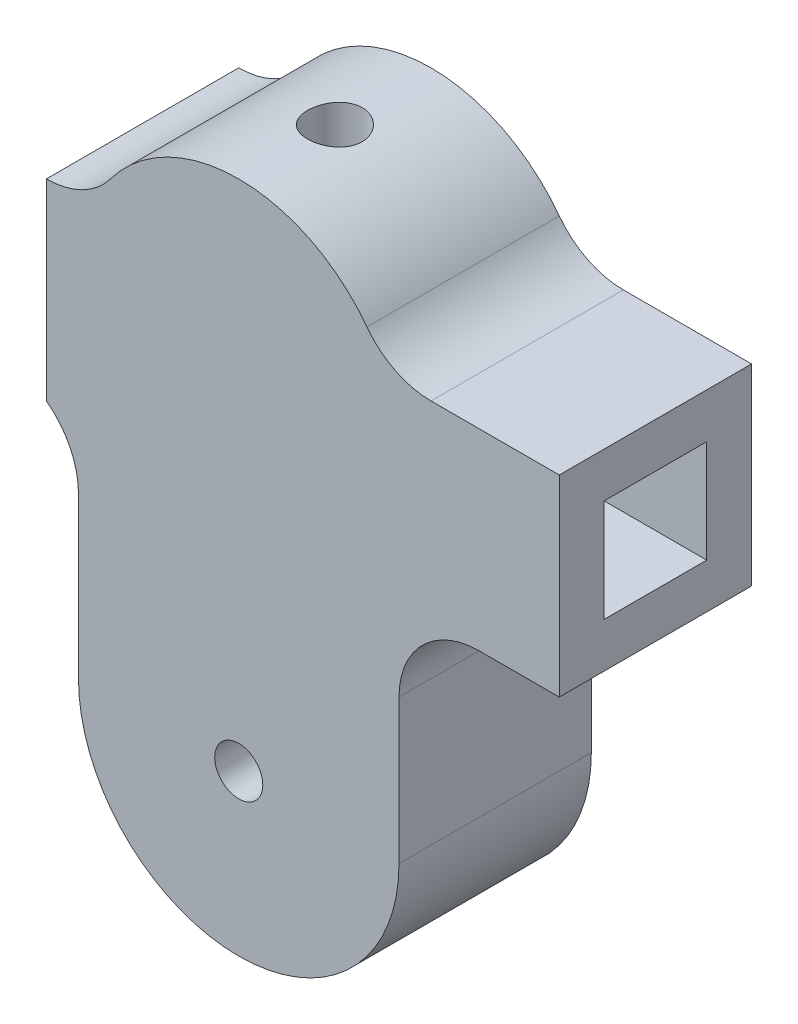
from build123d import *

# Parameters (mm, degrees)
BOSS_EXTRUDE1_DEPTH      = 12
SKETCH4_R                = 1.5
CUT_EXTRUDE2_DEPTH       = 36.60898763
BOSS_EXTRUDE2_DEPTH      = 20
BOSS_EXTRUDE2_DEPTH_BACK = 12
SKETCH7_W                = 12
SKETCH7_H                = 12
CUT_EXTRUDE1_DEPTH       = 2
SKETCH8_W                = 6.4
SKETCH8_H                = 6.4
CUT_EXTRUDE4_DEPTH       = 47.818799643
SKETCH9_W                = 5.6
SKETCH9_H                = 3.1
CUT_EXTRUDE5_DEPTH       = 9
SKETCH10_R               = 1.7
CUT_EXTRUDE6_DEPTH       = 41.573883226
FILLET1_R                = 5


with BuildPart() as part:
    # Sketch1 → Boss-Extrude1 (new body)
    with BuildSketch(Plane.XY):
        with BuildLine():
            Line((10, 22), (10, 0))
            ThreePointArc((10, 0), (0, -10), (-10, 0))
            Line((-10, 0), (-10, 22))
            ThreePointArc((-10, 22), (0, 32), (10, 22))
        make_face()
    extrude(amount=BOSS_EXTRUDE1_DEPTH)

    # Sketch4 → Cut-Extrude2 (cut, through all)
    with BuildSketch(Plane.XY):
        Circle(SKETCH4_R)
    extrude(amount=CUT_EXTRUDE2_DEPTH, mode=Mode.SUBTRACT)

    # Sketch7 → Boss-Extrude2 (add, two sides: drawn at the far end of the back side and taken through both)
    with BuildSketch(Plane(origin=(0, 0, 0), x_dir=(0, 0, -1), z_dir=(1, 0, 0)).offset(-BOSS_EXTRUDE2_DEPTH_BACK)):
        with Locations((-6, 20)):
            Rectangle(SKETCH7_W, SKETCH7_H)
    extrude(amount=BOSS_EXTRUDE2_DEPTH + BOSS_EXTRUDE2_DEPTH_BACK)

    # Sketch2 → Cut-Extrude1 (cut)
    with BuildSketch(Plane.XY):
        with BuildLine():
            Line((-2.5, 19.73937205), (-4.37, 0.209105237))
            ThreePointArc((-4.37, 0.209105237), (-0.209105237, -4.37), (4.37, -0.209105237))
            ThreePointArc((4.37, -0.209105237), (4.375, 0), (4.37, 0.209105237))
            Line((4.37, 0.209105237), (2.5, 19.73937205))
            ThreePointArc((2.5, 19.73937205), (0, 22.01143365), (-2.5, 19.73937205))
        make_face()
    extrude(amount=CUT_EXTRUDE1_DEPTH, mode=Mode.SUBTRACT)

    # Sketch8 → Cut-Extrude4 (cut, through all)
    with BuildSketch(Plane(origin=(20, 0, 0), x_dir=(0, 0, -1), z_dir=(1, 0, 0))):
        with Locations((-6, 20)):
            Rectangle(SKETCH8_W, SKETCH8_H)
    extrude(amount=-CUT_EXTRUDE4_DEPTH, mode=Mode.SUBTRACT)

    # Sketch9 → Cut-Extrude5 (cut)
    with BuildSketch(Plane(origin=(0, 0, 0), x_dir=(-1, 0, 0), z_dir=(0, 0, -1))):
        with Locations((0, 26.25)):
            Rectangle(SKETCH9_W, SKETCH9_H)
    extrude(amount=-CUT_EXTRUDE5_DEPTH, mode=Mode.SUBTRACT)

    # Sketch10 → Cut-Extrude6 (cut, through all)
    with BuildSketch(Plane.XZ.offset(-23.2)):
        with Locations(Location((0, 6, 0), (0, 0, 270))):
            Circle(SKETCH10_R)
    extrude(amount=-CUT_EXTRUDE6_DEPTH, mode=Mode.SUBTRACT)

    # Fillet1
    # the kernel refuses this fillet: 5 mm, written as the material it adds along each edge
    with BuildSketch(Plane(origin=(10, 14, 12), x_dir=(1, 0, 0), z_dir=(0, 0, -1))) as fillet1_piece_1:
        with BuildLine():
            CenterArc((FILLET1_R, FILLET1_R), FILLET1_R, 180, 90)
            Line((0, FILLET1_R), (-FILLET1_R * 0.02, FILLET1_R))
            Line((-FILLET1_R * 0.02, FILLET1_R), (-FILLET1_R * 0.02, -FILLET1_R * 0.02))
            Line((-FILLET1_R * 0.02, -FILLET1_R * 0.02), (FILLET1_R, -FILLET1_R * 0.02))
            Line((FILLET1_R, -FILLET1_R * 0.02), (FILLET1_R, 0))
        make_face()
    extrude(amount=12)
    with BuildSketch(Plane(origin=(-9.16515139, 26, 12), x_dir=(0.5033825030764704, 0.8640636872340298, 0), z_dir=(0, 0, -1))) as fillet1_piece_2:
        with BuildLine():
            CenterArc((2.893305247, -4.966402258), FILLET1_R, 96.645859584, 53.130102354)
            Line((-1.427013189, -2.449489743), (-1.513419558, -2.399151492))
            Line((-1.513419558, -2.399151492), (-0.086406369, 0.05033825))
            Line((-0.086406369, 0.05033825), (0.011573221, 0.099328045))
            ThreePointArc((0.011573221, 0.099328045), (1.157322099, 0.032804516), (2.303070977, 0.099328045))
            Line((2.303070977, 0.099328045), (2.314644198, 0))
        make_face()
    extrude(amount=12)
    with BuildSketch(Plane(origin=(9.16515139, 26, 12), x_dir=(1, 0, 0), z_dir=(0, 0, -1))) as fillet1_piece_3:
        with BuildLine():
            CenterArc((2.83484861, -5), FILLET1_R, 90, 53.130102354)
            Line((-1.16515139, -2), (-1.24515139, -1.94))
            ThreePointArc((-1.24515139, -1.94), (-0.610920886, -0.98348678), (-0.091651514, 0.04))
            Line((-0.091651514, 0.04), (0, 0.1))
            Line((0, 0.1), (2.83484861, 0.1))
            Line((2.83484861, 0.1), (2.83484861, 0))
        make_face()
    extrude(amount=12)
    with BuildSketch(Plane(origin=(-10, 14, 0), x_dir=(-1, 0, 0), z_dir=(0, 0, 1))) as fillet1_piece_4:
        with BuildLine():
            CenterArc((5, 4), FILLET1_R, 180, 53.130102354)
            Line((0, 4), (-0.1, 4))
            Line((-0.1, 4), (-0.1, 0))
            Line((-0.1, 0), (0, -0.1))
            ThreePointArc((0, -0.1), (1, -0.1), (1.94, -0.08))
            Line((1.94, -0.08), (2, 0))
        make_face()
    extrude(amount=12)


solid = part.part
